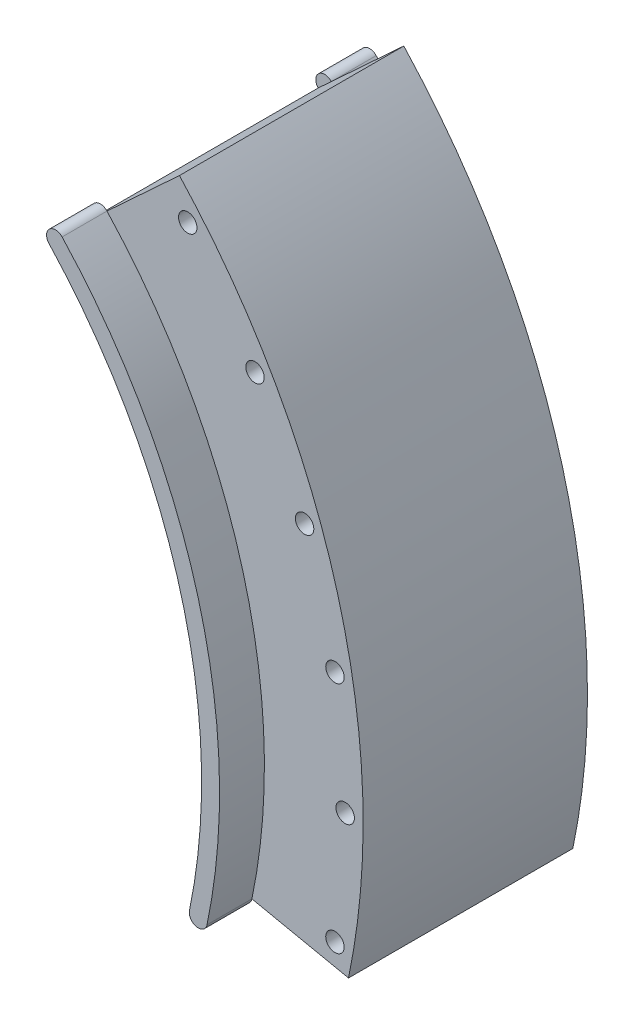
from build123d import *

# Parameters (mm, degrees)
BOSS_EXTRUDE2_DEPTH = 15.875
SKETCH3_R           = 3.2639
BOSS_EXTRUDE3_DEPTH = 79.375


with BuildPart() as part:
    # Sketch1 → Boss-Extrude2 (new body)
    with BuildSketch(Plane.XY):
        with BuildLine():
            ThreePointArc((149.187093896, 137.961773745), (189.215561569, 74.079087873), (203.2, 0))
            ThreePointArc((203.2, 0), (202.123085284, -20.892544009), (198.903755953, -41.563636364))
            ThreePointArc((198.903755953, -41.563636364), (201.362195322, -45.320939369), (205.119498327, -42.8625))
            ThreePointArc((205.119498327, -42.8625), (208.439431699, -21.545436009), (209.55, 0))
            ThreePointArc((209.55, 0), (195.128547868, 76.394059369), (153.84919058, 142.273079174))
            ThreePointArc((153.84919058, 142.273079174), (149.362489524, 142.448474802), (149.187093896, 137.961773745))
        make_face()
    boss_extrude2 = extrude(amount=BOSS_EXTRUDE2_DEPTH)

    # Sketch3 → Boss-Extrude3 (add)
    with BuildSketch(Plane.XY.offset(15.875)):
        with BuildLine():
            Line((149.187093896, 137.961773745), (179.490722344, 165.985259037))
            ThreePointArc((179.490722344, 165.985259037), (235.607244576, 65.247620098), (239.306081381, -50.00625))
            Line((239.306081381, -50.00625), (198.903755953, -41.563636364))
            ThreePointArc((198.903755953, -41.563636364), (195.829398089, 54.231788134), (149.187093896, 137.961773745))
        make_face()
        with Locations((238.125, 0)):
            Circle(SKETCH3_R, mode=Mode.SUBTRACT)
        with Locations((234.507346186, 41.349972307)):
            Circle(SKETCH3_R, mode=Mode.SUBTRACT)
        with Locations((223.764305325, 81.443546629)):
            Circle(SKETCH3_R, mode=Mode.SUBTRACT)
        with Locations((206.222299276, 119.0625)):
            Circle(SKETCH3_R, mode=Mode.SUBTRACT)
        with Locations((182.414333018, 153.063799557)):
            Circle(SKETCH3_R, mode=Mode.SUBTRACT)
        with Locations((234.507346186, -41.349972307)):
            Circle(SKETCH3_R, mode=Mode.SUBTRACT)
    extrude(amount=BOSS_EXTRUDE3_DEPTH)

    # Mirror1: Boss-Extrude2 across plane
    add(boss_extrude2.mirror(Plane(origin=(0, 0, 55.5625), x_dir=(1, 0, 0), z_dir=(0, 0, -1))))


solid = part.part
